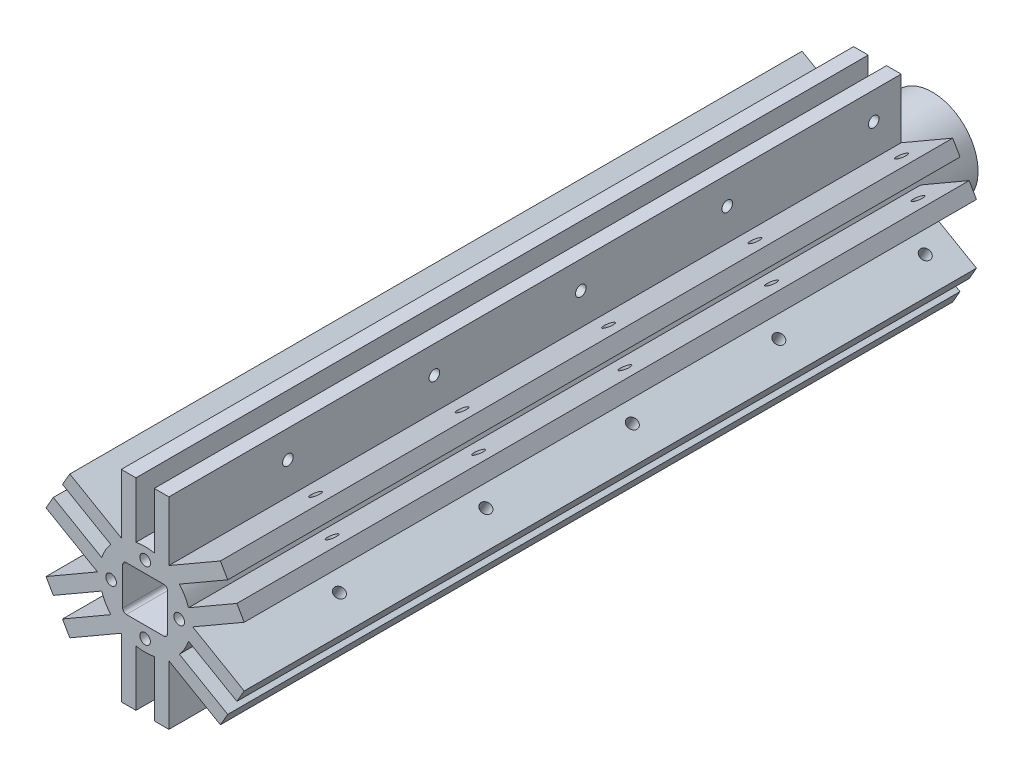
from build123d import *
from build123d.topology import SkipClean

# Parameters (mm, degrees)
SKETCH1_R           = 12.5
BOSS_EXTRUDE1_DEPTH = 100
SKETCH4_W           = 4
SKETCH4_H           = 27.5
BOSS_EXTRUDE3_DEPTH = 200
CIRPATTERN7_COUNT   = 6
SKETCH7_R           = 1.45
CUT_EXTRUDE2_DEPTH  = 17
CIRPATTERN9_COUNT   = 6
SKETCH10_R          = 12.5
BOSS_EXTRUDE4_DEPTH = 15
CUT_EXTRUDE3_REACH  = 220.435
SKETCH8_W           = 12.25
SKETCH8_H           = 12.25
SKETCH9_R           = 1.45
CUT_EXTRUDE4_DEPTH  = 10
FILLET1_R           = 1


with BuildPart() as part:
    # Sketch1 → Boss-Extrude1 (new, symmetric)
    with BuildSketch(Plane.XY):
        Circle(SKETCH1_R)
    extrude(amount=BOSS_EXTRUDE1_DEPTH, both=True)

    # Sketch4 → Boss-Extrude3 (add)
    with BuildSketch(Plane.XY.offset(100)):
        with Locations((-4.5, 13.75)):
            Rectangle(SKETCH4_W, SKETCH4_H)
        with Locations((4.5, 13.75)):
            Rectangle(SKETCH4_W, SKETCH4_H)
    boss_extrude3 = extrude(amount=-BOSS_EXTRUDE3_DEPTH)

    # CirPattern7: Boss-Extrude3 ×6 about axis
    cirpattern7_axis = Axis((0, 0, 0), (0, 0, 1))
    for i in range(1, CIRPATTERN7_COUNT):
        add(boss_extrude3.rotate(cirpattern7_axis, i * 360 / CIRPATTERN7_COUNT))

    # Sketch7 → Cut-Extrude2 (cut)
    with BuildSketch(Plane.ZY.offset(6.5)):
        with Locations((-92.5, 20)):
            Circle(SKETCH7_R)
        with Locations((-52.5, 20)):
            Circle(SKETCH7_R)
        with Locations((-12.5, 20)):
            Circle(SKETCH7_R)
        with Locations((27.5, 20)):
            Circle(SKETCH7_R)
        with Locations((67.5, 20)):
            Circle(SKETCH7_R)
    cut_extrude2 = extrude(amount=-CUT_EXTRUDE2_DEPTH, mode=Mode.SUBTRACT)

    # CirPattern9: Cut-Extrude2 ×6 about axis
    cirpattern9_axis = Axis((0, 0, 100), (0, 0, 1))
    for i in range(1, CIRPATTERN9_COUNT):
        add(cut_extrude2.rotate(cirpattern9_axis, i * 360 / CIRPATTERN9_COUNT), mode=Mode.SUBTRACT)

    # Sketch10 → Boss-Extrude4 (add)
    with SkipClean():  # the faces are left unmerged after this step: merging them gives an invalid solid
        with BuildSketch(Plane(origin=(0, 0, -100), x_dir=(-1, 0, 0), z_dir=(0, 0, -1))):
            Circle(SKETCH10_R)
        extrude(amount=BOSS_EXTRUDE4_DEPTH)
    add(part.part.scale(1), mode=Mode.REPLACE)  # the faces are merged on a copy

    # Sketch8 → Cut-Extrude3 (cut, up to next)
    with BuildSketch(Plane.XY.offset(100), mode=Mode.PRIVATE) as cut_extrude3_sk1:
        Rectangle(SKETCH8_W, SKETCH8_H)
    cut_extrude3_tool1 = extrude(cut_extrude3_sk1.sketch, amount=-CUT_EXTRUDE3_REACH, mode=Mode.PRIVATE) & part.part
    add(cut_extrude3_tool1.solids().sort_by_distance((0, 0, 100))[0], mode=Mode.SUBTRACT)

    # Sketch9 → Cut-Extrude4 (cut)
    with BuildSketch(Plane.XY.offset(100)):
        with Locations((9.3125, 0)):
            Circle(SKETCH9_R)
        with Locations((0, -9.2875)):
            Circle(SKETCH9_R)
        with Locations((-9.2875, 0.025)):
            Circle(SKETCH9_R)
        with Locations((0.025, 9.3125)):
            Circle(SKETCH9_R)
    extrude(amount=-CUT_EXTRUDE4_DEPTH, mode=Mode.SUBTRACT)

    # Fillet1
    fillet1_edges = [part.edges().sort_by_distance(p)[0] for p in [
        (6.125, 6.125, -7.5),
        (6.125, -6.125, -7.5),
        (-6.125, -6.125, -7.5),
        (-6.125, 6.125, -7.5),
    ]]
    fillet(fillet1_edges, radius=FILLET1_R)


solid = part.part
